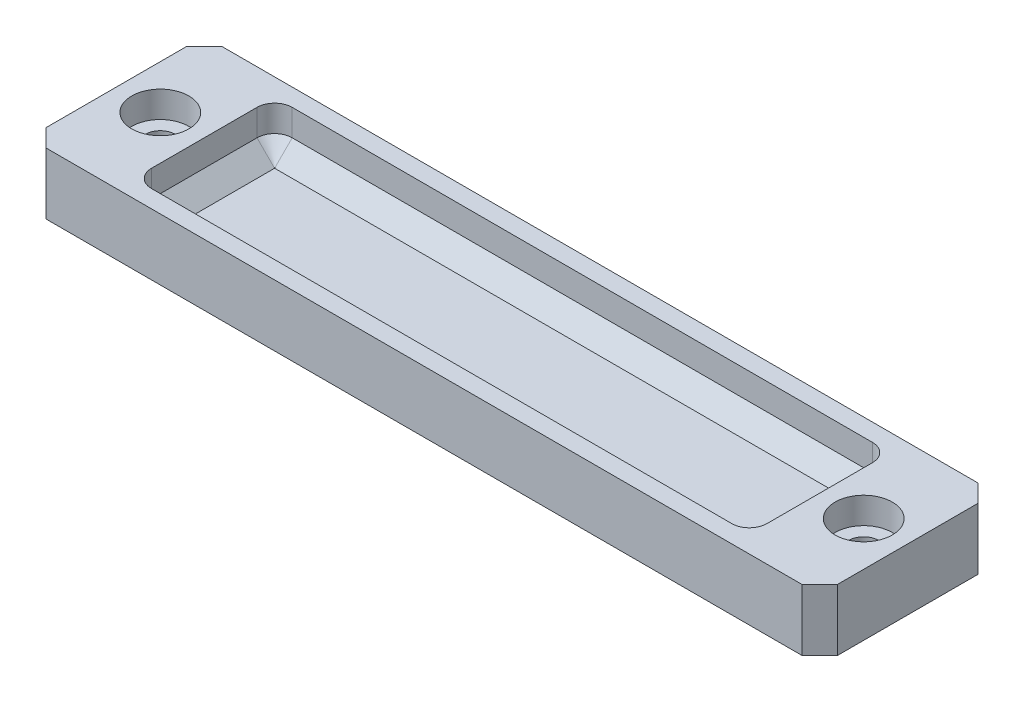
from build123d import *

# Parameters (mm, degrees)
SKETCH1_W                      = 90
SKETCH1_H                      = 20
BOSS_EXTRUDE1_DEPTH            = 7
CBORE_START                    = 4
CBORE_FOR_M3_SHCS1_OUTLINE_R   = 3.25
CBORE_FOR_M3_SHCS1_DEPTH       = 3
CBORE_FOR_M3_SHCS1_2_OUTLINE_R = 1.7
CBORE_FOR_M3_SHCS1_2_DEPTH     = 4
SKETCH4_W                      = 70
SKETCH4_H                      = 16
CUT_EXTRUDE1_DEPTH             = 5
CHAMFER1_SIZE                  = 2
FILLET1_R                      = 2
CHAMFER2_SIZE                  = 2


# Read off the part's stored shape, not the designer's step: CBORE for M3 SHCS1
with BuildPart() as part:
    # Sketch1 → Boss-Extrude1 (new body)
    with BuildSketch(Plane(origin=(0, 0, 0), x_dir=(1, 0, 0), z_dir=(0, 1, 0))):
        Rectangle(SKETCH1_W, SKETCH1_H)
    extrude(amount=BOSS_EXTRUDE1_DEPTH)

    # CBORE for M3 SHCS1 outline → CBORE for M3 SHCS1 (cut)
    with BuildSketch(Plane(origin=(0, 0, 0), x_dir=(1, 0, 0), z_dir=(0, 1, 0)).offset(CBORE_START)):
        with Locations((-40, 0)):
            Circle(CBORE_FOR_M3_SHCS1_OUTLINE_R)
        with Locations((40, 0)):
            Circle(CBORE_FOR_M3_SHCS1_OUTLINE_R)
    extrude(amount=CBORE_FOR_M3_SHCS1_DEPTH, mode=Mode.SUBTRACT)

    # CBORE for M3 SHCS1 2 outline → CBORE for M3 SHCS1 2 (cut)
    with BuildSketch(Plane(origin=(0, 0, 0), x_dir=(1, 0, 0), z_dir=(0, 1, 0))):
        with Locations((-40, 0)):
            Circle(CBORE_FOR_M3_SHCS1_2_OUTLINE_R)
        with Locations((40, 0)):
            Circle(CBORE_FOR_M3_SHCS1_2_OUTLINE_R)
    extrude(amount=CBORE_FOR_M3_SHCS1_2_DEPTH, mode=Mode.SUBTRACT)

    # Sketch4 → Cut-Extrude1 (cut)
    with BuildSketch(Plane(origin=(0, 7, 0), x_dir=(1, 0, 0), z_dir=(0, 1, 0))):
        Rectangle(SKETCH4_W, SKETCH4_H)
    extrude(amount=-CUT_EXTRUDE1_DEPTH, mode=Mode.SUBTRACT)

    # Chamfer1
    chamfer1_edges = [part.edges().sort_by_distance(p)[0] for p in [
        (45, 3.5, 10),
        (-45, 3.5, 10),
        (-45, 3.5, -10),
        (45, 3.5, -10),
    ]]
    chamfer(chamfer1_edges, length=CHAMFER1_SIZE)

    # Fillet1
    fillet1_edges = [part.edges().sort_by_distance(p)[0] for p in [
        (-35, 4.5, -8),
        (-35, 4.5, 8),
        (35, 4.5, 8),
        (35, 4.5, -8),
    ]]
    fillet(fillet1_edges, radius=FILLET1_R)

    # Chamfer2
    chamfer2_edges = [part.edges().sort_by_distance(p)[0] for p in [
        (35, 2, 0),
        (0, 2, 8),
        (0, 2, -8),
        (-35, 2, 0),
        (-34.414213562, 2, 7.414213562),
        (-34.414213562, 2, -7.414213562),
        (34.414213562, 2, -7.414213562),
        (34.414213562, 2, 7.414213562),
    ]]
    chamfer(chamfer2_edges, length=CHAMFER2_SIZE)


solid = part.part
